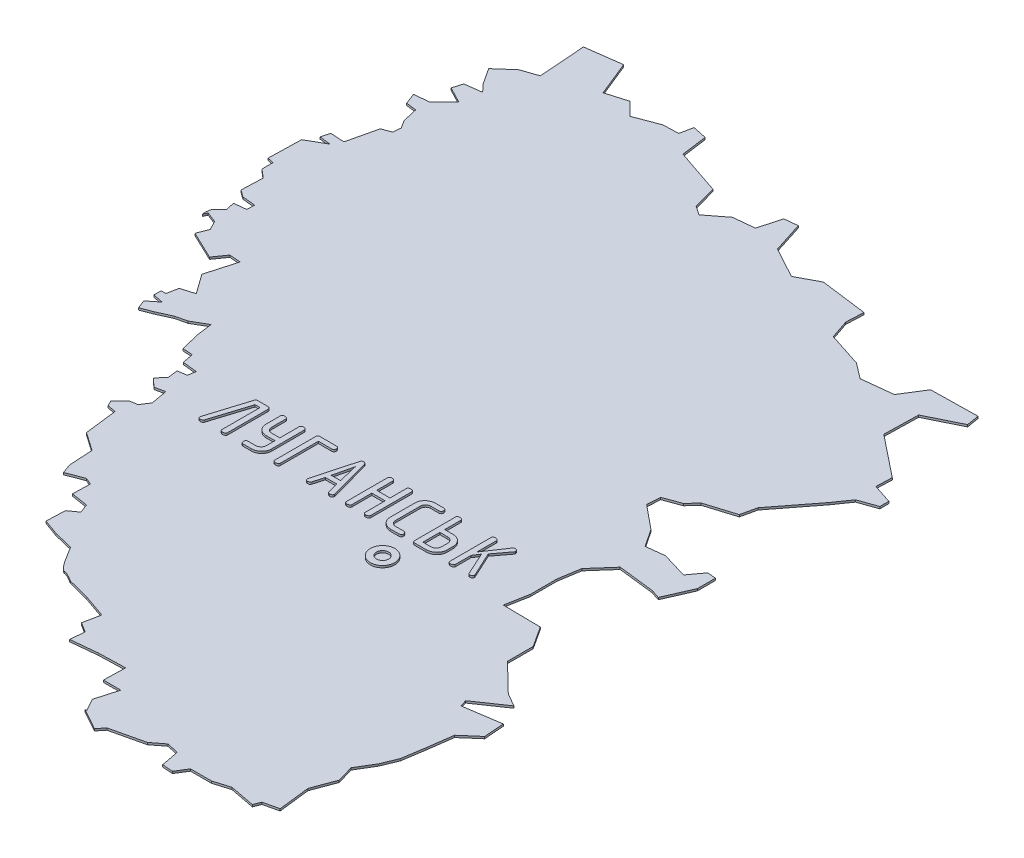
from build123d import *

# Parameters (mm, degrees)
EXTRUDE_7_DEPTH = 5
SKETCH_2_R      = 30
SKETCH_2_R_2    = 15
EXTRUDE_8_DEPTH = 10
SCALE_1_SCALE   = 0.05


with BuildPart() as part:
    # Эскиз1 → Бобышка-Вытянуть7 (new body)
    with BuildSketch(Plane(origin=(0, 0, 0), x_dir=(1, 0, 0), z_dir=(0, 1, 0))):
        with BuildLine():
            Line((5488.13228, 6459.56798), (5449.19408, 6425.18654))
            Line((5449.19408, 6425.18654), (5474.51788, 6386.2458))
            Line((5474.51788, 6386.2458), (5492.02864, 6367.4244))
            Line((5492.02864, 6367.4244), (5451.1448, 6362.22502))
            Line((5451.1448, 6362.22502), (5444.01248, 6338.2017))
            Line((5444.01248, 6338.2017), (5483.60092, 6317.4626))
            Line((5483.60092, 6317.4626), (5447.25098, 6281.76036))
            Line((5447.25098, 6281.76036), (5411.5843, 6278.50916))
            Line((5411.5843, 6278.50916), (5421.95258, 6251.25242))
            Line((5421.95258, 6251.25242), (5447.25098, 6248.01392))
            Line((5447.25098, 6248.01392), (5455.66854, 6211.66398))
            Line((5455.66854, 6211.66398), (5468.05104, 6191.55988))
            Line((5468.05104, 6191.55988), (5466.08254, 6172.75626))
            Line((5466.08254, 6172.75626), (5444.01248, 6164.29806))
            Line((5444.01248, 6164.29806), (5427.1418, 6092.2662))
            Line((5427.1418, 6092.2662), (5392.77814, 6094.20676))
            Line((5392.77814, 6094.20676), (5387.5813, 6073.44988))
            Line((5387.5813, 6073.44988), (5414.81264, 6070.20122))
            Line((5414.81264, 6070.20122), (5370.67506, 6044.89266))
            Line((5370.67506, 6044.89266), (5368.73196, 5964.43054))
            Line((5368.73196, 5964.43054), (5384.29962, 5961.17934))
            Line((5384.29962, 5961.17934), (5384.29962, 5933.9353))
            Line((5384.29962, 5933.9353), (5405.08952, 5916.41184))
            Line((5405.08952, 5916.41184), (5403.12102, 5863.8567))
            Line((5403.12102, 5863.8567), (5420.00186, 5851.51484))
            Line((5420.00186, 5851.51484), (5452.4402, 5848.25348))
            Line((5452.4402, 5848.25348), (5451.1448, 5829.46764))
            Line((5451.1448, 5829.46764), (5421.95258, 5826.20628))
            Line((5421.95258, 5826.20628), (5427.1418, 5805.4367))
            Line((5427.1418, 5805.4367), (5408.33564, 5786.6153))
            Line((5408.33564, 5786.6153), (5406.36714, 5771.69534))
            Line((5406.36714, 5771.69534), (5407.025, 5765.2158))
            Line((5407.025, 5765.2158), (5411.5843, 5774.94654))
            Line((5411.5843, 5774.94654), (5437.53802, 5764.5681))
            Line((5437.53802, 5764.5681), (5449.19408, 5742.50058))
            Line((5449.19408, 5742.50058), (5438.79786, 5715.24892))
            Line((5438.79786, 5715.24892), (5506.93844, 5682.7801))
            Line((5506.93844, 5682.7801), (5527.7385, 5712.00026))
            Line((5527.7385, 5712.00026), (5554.98, 5710.05716))
            Line((5554.98, 5710.05716), (5534.21296, 5636.73498))
            Line((5534.21296, 5636.73498), (5568.6198, 5588.6858))
            Line((5568.6198, 5588.6858), (5536.18146, 5578.95506))
            Line((5536.18146, 5578.95506), (5530.96684, 5551.69832))
            Line((5530.96684, 5551.69832), (5519.2676, 5551.69832))
            Line((5519.2676, 5551.69832), (5519.2676, 5534.17486))
            Line((5519.2676, 5534.17486), (5544.60156, 5528.99834))
            Line((5544.60156, 5528.99834), (5519.2676, 5508.88662))
            Line((5519.2676, 5508.88662), (5527.7385, 5488.11196))
            Line((5527.7385, 5488.11196), (5554.98, 5498.49548))
            Line((5554.98, 5498.49548), (5589.35128, 5514.07584))
            Line((5589.35128, 5514.07584), (5616.6004, 5520.563))
            Line((5616.6004, 5520.563), (5652.32804, 5541.33258))
            Line((5652.32804, 5541.33258), (5657.50964, 5501.73652))
            Line((5657.50964, 5501.73652), (5669.18094, 5455.66092))
            Line((5669.18094, 5455.66092), (5693.21188, 5454.37568))
            Line((5693.21188, 5454.37568), (5698.39094, 5427.10878))
            Line((5698.39094, 5427.10878), (5734.06778, 5423.22258))
            Line((5734.06778, 5423.22258), (5730.82928, 5404.38848))
            Line((5730.82928, 5404.38848), (5708.78716, 5401.13982))
            Line((5708.78716, 5401.13982), (5712.03328, 5377.15206))
            Line((5712.03328, 5377.15206), (5695.188, 5357.01494))
            Line((5695.188, 5357.01494), (5715.31496, 5338.20624))
            Line((5715.31496, 5338.20624), (5739.26462, 5343.39546))
            Line((5739.26462, 5343.39546), (5746.41472, 5302.52178))
            Line((5746.41472, 5302.52178), (5732.79016, 5281.7522))
            Line((5732.79016, 5281.7522), (5713.9586, 5278.50608))
            Line((5713.9586, 5278.50608), (5691.26116, 5256.45126))
            Line((5691.26116, 5256.45126), (5698.39094, 5242.8267))
            Line((5698.39094, 5242.8267), (5719.17322, 5238.9151))
            Line((5719.17322, 5238.9151), (5728.88618, 5159.10576))
            Line((5728.88618, 5159.10576), (5773.65622, 5127.95266))
            Line((5773.65622, 5127.95266), (5776.92774, 5070.21338))
            Line((5776.92774, 5070.21338), (5785.36308, 5046.19768))
            Line((5785.36308, 5046.19768), (5826.22914, 5061.77296))
            Line((5826.22914, 5061.77296), (5843.08204, 5054.59746))
            Line((5843.08204, 5054.59746), (5841.81204, 5011.80354))
            Line((5841.81204, 5011.80354), (5882.6781, 5005.30622))
            Line((5882.6781, 5005.30622), (5891.11344, 4983.24632))
            Line((5891.11344, 4983.24632), (5869.06116, 4967.65072))
            Line((5869.06116, 4967.65072), (5867.11044, 4921.6056))
            Line((5867.11044, 4921.6056), (5904.738, 4907.95056))
            Line((5904.738, 4907.95056), (5952.79734, 4896.26148))
            add(Edge.make_bspline(
                [(5952.79734, 4896.26148), (5985.20774, 4839.83792), (5995.62174, 4837.89482)],
                knots=[0.435483871, 0.435483871, 0.435483871, 0.440860215, 0.440860215, 0.440860215], degree=2))
            add(Edge.make_bspline(
                [(5995.62174, 4837.89482), (6005.32454, 4836.57402), (6024.1561, 4824.25756)],
                knots=[0.440860215, 0.440860215, 0.440860215, 0.446236559, 0.446236559, 0.446236559], degree=2))
            Line((6024.1561, 4824.25756), (6077.35894, 4810.633))
            Line((6077.35894, 4810.633), (6135.13124, 4790.5162))
            Line((6135.13124, 4790.5162), (6126.70352, 4748.97704))
            Line((6126.70352, 4748.97704), (6150.6989, 4734.03168))
            Line((6150.6989, 4734.03168), (6147.47818, 4699.02032))
            Line((6147.47818, 4699.02032), (6212.32692, 4705.49732))
            Line((6212.32692, 4705.49732), (6276.60924, 4707.44804))
            Line((6276.60924, 4707.44804), (6275.27066, 4654.23758))
            Line((6275.27066, 4654.23758), (6318.11284, 4654.23758))
            Line((6318.11284, 4654.23758), (6302.53756, 4599.72156))
            Line((6302.53756, 4599.72156), (6319.42602, 4569.22378))
            Line((6319.42602, 4569.22378), (6314.91244, 4569.22378))
            Line((6314.91244, 4569.22378), (6324.59746, 4564.02694))
            Line((6324.59746, 4564.02694), (6367.4752, 4539.98838))
            Line((6367.4752, 4539.98838), (6381.07436, 4556.9124))
            Line((6381.07436, 4556.9124), (6461.56188, 4575.72618))
            Line((6461.56188, 4575.72618), (6490.09624, 4597.77846))
            Line((6490.09624, 4597.77846), (6519.28846, 4591.27606))
            Line((6519.28846, 4591.27606), (6527.7492, 4547.1461))
            Line((6527.7492, 4547.1461), (6553.68768, 4545.21316))
            Line((6553.68768, 4545.21316), (6570.55836, 4572.46228))
            Line((6570.55836, 4572.46228), (6621.83588, 4572.46228))
            Line((6621.83588, 4572.46228), (6660.79186, 4584.1285))
            Line((6660.79186, 4584.1285), (6722.40464, 4572.46228))
            Line((6722.40464, 4572.46228), (6728.92482, 4589.33296))
            Line((6728.92482, 4589.33296), (6765.24936, 4597.77846))
            Line((6765.24936, 4597.77846), (6756.15616, 4675.00208))
            Line((6756.15616, 4675.00208), (6776.96638, 4730.78556))
            Line((6776.96638, 4730.78556), (6765.24936, 4771.71004))
            Line((6765.24936, 4771.71004), (6790.55538, 4813.88674))
            Line((6790.55538, 4813.88674), (6806.13066, 4851.49652))
            Line((6806.13066, 4851.49652), (6814.566, 4906.01762))
            Line((6814.566, 4906.01762), (6822.96832, 4967.65072))
            Line((6822.96832, 4967.65072), (6862.58978, 5002.06264))
            Line((6862.58978, 5002.06264), (6858.70612, 5051.37674))
            Line((6858.70612, 5051.37674), (6768.5031, 5037.74964))
            Line((6768.5031, 5037.74964), (6763.29864, 5054.59746))
            Line((6763.29864, 5054.59746), (6833.38994, 5102.63902))
            Line((6833.38994, 5102.63902), (6800.93382, 5121.46042))
            Line((6800.93382, 5121.46042), (6730.84252, 5189.601))
            Line((6730.84252, 5189.601), (6730.84252, 5252.54728))
            Line((6730.84252, 5252.54728), (6698.40418, 5302.52178))
            Line((6698.40418, 5302.52178), (6606.27838, 5303.82988))
            Line((6606.27838, 5303.82988), (6616.64666, 5360.26106))
            Line((6616.64666, 5360.26106), (6616.64666, 5425.16568))
            Line((6616.64666, 5425.16568), (6625.082, 5477.7259))
            Line((6625.082, 5477.7259), (6669.2018, 5527.69532))
            Line((6669.2018, 5527.69532), (6758.11704, 5517.32196))
            Line((6758.11704, 5517.32196), (6780.16932, 5510.18202))
            Line((6780.16932, 5510.18202), (6809.35138, 5577.02212))
            Line((6809.35138, 5577.02212), (6809.35138, 5621.147))
            Line((6809.35138, 5621.147), (6788.60466, 5623.07994))
            Line((6788.60466, 5623.07994), (6763.29864, 5588.6858))
            Line((6763.29864, 5588.6858), (6700.33712, 5607.51228))
            Line((6700.33712, 5607.51228), (6655.562, 5602.31544))
            Line((6655.562, 5602.31544), (6626.9997, 5645.15508))
            Line((6626.9997, 5645.15508), (6568.60764, 5693.16362))
            Line((6568.60764, 5693.16362), (6570.55836, 5725.61466))
            Line((6570.55836, 5725.61466), (6611.45744, 5740.56256))
            Line((6611.45744, 5740.56256), (6632.23972, 5763.26))
            Line((6632.23972, 5763.26), (6703.56546, 5785.3326))
            Line((6703.56546, 5785.3326), (6711.98302, 5822.97286))
            Line((6711.98302, 5822.97286), (6787.32704, 5920.31074))
            Line((6787.32704, 5920.31074), (6814.566, 5959.23878))
            Line((6814.566, 5959.23878), (6858.70612, 5974.81406))
            Line((6858.70612, 5974.81406), (6858.70612, 5996.86888))
            Line((6858.70612, 5996.86888), (6811.29448, 6012.45432))
            Line((6811.29448, 6012.45432), (6812.61528, 6051.39252))
            Line((6812.61528, 6051.39252), (6710.08564, 6133.15512))
            Line((6710.08564, 6133.15512), (6711.98302, 6216.8786))
            Line((6711.98302, 6216.8786), (6792.5061, 6256.45434))
            Line((6792.5061, 6256.45434), (6787.32704, 6286.9572))
            Line((6787.32704, 6286.9572), (6673.09562, 6285.01918))
            Line((6673.09562, 6285.01918), (6638.71672, 6230.49046))
            Line((6638.71672, 6230.49046), (6563.43366, 6222.06528))
            Line((6563.43366, 6222.06528), (6524.49546, 6251.25242))
            Line((6524.49546, 6251.25242), (6440.75166, 6278.50916))
            Line((6440.75166, 6278.50916), (6425.17638, 6324.60254))
            Line((6425.17638, 6324.60254), (6427.14488, 6367.4244))
            Line((6427.14488, 6367.4244), (6312.916, 6382.34436))
            Line((6312.916, 6382.34436), (6261.67404, 6355.09524))
            Line((6261.67404, 6355.09524), (6186.3732, 6395.97654))
            Line((6186.3732, 6395.97654), (6162.38036, 6471.25706))
            Line((6162.38036, 6471.25706), (6129.96742, 6468.01856))
            Line((6129.96742, 6468.01856), (6114.99666, 6413.49492))
            Line((6114.99666, 6413.49492), (6063.72676, 6408.31078))
            Line((6063.72676, 6408.31078), (6017.67148, 6372.60854))
            Line((6017.67148, 6372.60854), (5995.62174, 6387.53358))
            Line((5995.62174, 6387.53358), (5980.0617, 6444.01302))
            Line((5980.0617, 6444.01302), (5869.06116, 6481.6228))
            Line((5869.06116, 6481.6228), (5860.60042, 6544.59194))
            Line((5860.60042, 6544.59194), (5826.22914, 6551.72426))
            Line((5826.22914, 6551.72426), (5819.77754, 6520.58386))
            Line((5819.77754, 6520.58386), (5782.11696, 6519.28592))
            Line((5782.11696, 6519.28592), (5723.7249, 6497.20316))
            Line((5723.7249, 6497.20316), (5691.26116, 6529.0065))
            Line((5691.26116, 6529.0065), (5640.64658, 6514.084))
            Line((5640.64658, 6514.084), (5606.23974, 6599.09018))
            Line((5606.23974, 6599.09018), (5519.2676, 6587.40872))
            Line((5519.2676, 6587.40872), (5527.7385, 6473.18746))
            Line((5527.7385, 6473.18746), (5488.13228, 6459.56798))
        make_face()
    extrude(amount=EXTRUDE_7_DEPTH)

    # Эскиз2 → Бобышка-Вытянуть8 (add)
    # profile 1 of 9: a face of its own
    with BuildSketch(Plane(origin=(0, 0, 0), x_dir=(1, 0, 0), z_dir=(0, 1, 0))):
        with Locations((6358.100749634, 5256.002321713)):
            Circle(SKETCH_2_R)
        with Locations((6358.100749634, 5256.002321713)):
            Circle(SKETCH_2_R_2, mode=Mode.SUBTRACT)
    # profile 2 of 9: a face of its own
    with BuildSketch(Plane(origin=(0, 0, 0), x_dir=(1, 0, 0), z_dir=(0, 1, 0))):
        with BuildLine():
            add(Edge.make_bspline(
                [(5907.01062367, 5327.256922732), (5906.992182529, 5326.835668227), (5906.957288543, 5326.038578261), (5906.588560272, 5324.924943171), (5906.006213528, 5323.969128424), (5905.151626094, 5323.206311019), (5904.077030574, 5322.625501675), (5902.779041095, 5322.209033108), (5901.249602894, 5321.996461411), (5900.159426741, 5321.958387605), (5899.578191238, 5321.938088273)],
                knots=[0, 0, 0, 0, 0.969647621, 1.834749252, 2.678145047, 3.526077294, 4.446504318, 5.481227067, 6.657097526, 8, 8, 8, 8], degree=3))
            add(Edge.make_bspline(
                [(5899.578191238, 5321.938088273), (5899.112901019, 5321.958335105), (5898.237879901, 5321.99641114), (5897.006515942, 5322.212069779), (5895.961291597, 5322.633003449), (5895.107162745, 5323.223218695), (5894.419635608, 5323.96803962), (5893.959527946, 5324.902714674), (5893.676744824, 5325.994018893), (5893.647619502, 5326.774994654), (5893.632245292, 5327.187243678)],
                knots=[0, 0, 0, 0, 1.231142298, 2.315276502, 3.288579949, 4.185921389, 5.041168779, 5.938510218, 6.911813665, 8, 8, 8, 8], degree=3))
            Line((5893.632245292, 5327.187243678), (5893.632245292, 5420.046196381))
            Line((5893.632245292, 5420.046196381), (5881.322279076, 5420.046196381))
            Line((5881.322279076, 5420.046196381), (5851.639002049, 5325.67753084))
            add(Edge.make_bspline(
                [(5851.639002049, 5325.67753084), (5851.401384237, 5325.108299549), (5850.930620134, 5323.980548828), (5849.458579502, 5322.73704847), (5847.509006126, 5322.035895245), (5846.063663266, 5321.972617238), (5845.274981779, 5321.938088273)],
                knots=[0, 0, 0, 0, 0.920783868, 1.824240315, 2.812751332, 4, 4, 4, 4], degree=3))
            add(Edge.make_bspline(
                [(5845.274981779, 5321.938088273), (5844.840909494, 5321.958992279), (5844.020180279, 5321.998516868), (5842.861085607, 5322.208186636), (5841.89271693, 5322.64479588), (5841.061741226, 5323.198604113), (5840.451256647, 5323.978726847), (5840.00500688, 5324.895955584), (5839.7497636, 5325.981763405), (5839.717758215, 5326.75230835), (5839.700657454, 5327.164017327)],
                knots=[0, 0, 0, 0, 1.192508042, 2.254753928, 3.205852217, 4.08983164, 4.9656069, 5.887070154, 6.871042903, 8, 8, 8, 8], degree=3))
            add(Edge.make_bspline(
                [(5839.700657454, 5327.164017327), (5839.72420906, 5327.45167498), (5839.77171691, 5328.031932512), (5839.909762824, 5328.597549878), (5839.97937367, 5328.882767327)],
                knots=[0, 0, 0, 0, 0.991482704, 2, 2, 2, 2], degree=3))
            Line((5839.97937367, 5328.882767327), (5870.823968265, 5428.198645705))
            add(Edge.make_bspline(
                [(5870.823968265, 5428.198645705), (5871.044767741, 5428.760050899), (5871.465387876, 5429.829520504), (5872.641523624, 5431.093098808), (5874.205753604, 5431.827812343), (5875.352838264, 5431.900044561), (5875.956991914, 5431.938088273)],
                knots=[0, 0, 0, 0, 1.049874067, 1.999996468, 2.94662576, 4, 4, 4, 4], degree=3))
            Line((5875.956991914, 5431.938088273), (5899.578191238, 5431.938088273))
            add(Edge.make_bspline(
                [(5899.578191238, 5431.938088273), (5900.159426741, 5431.91778894), (5901.249602894, 5431.879715134), (5902.779041095, 5431.667143438), (5904.077030574, 5431.250674871), (5905.151626094, 5430.669865526), (5906.006213528, 5429.907048121), (5906.588560272, 5428.951233374), (5906.957288543, 5427.837598285), (5906.992182529, 5427.040508319), (5907.01062367, 5426.619253813)],
                knots=[0, 0, 0, 0, 1.342902474, 2.518772933, 3.553495682, 4.473922706, 5.321854953, 6.165250748, 7.030352379, 8, 8, 8, 8], degree=3))
            Line((5907.01062367, 5426.619253813), (5907.01062367, 5327.256922732))
        make_face()
    # profile 3 of 9: a face of its own
    with BuildSketch(Plane(origin=(0, 0, 0), x_dir=(1, 0, 0), z_dir=(0, 1, 0))):
        with BuildLine():
            Line((5982.226839887, 5368.019169354), (5960.62633313, 5368.019169354))
            add(Edge.make_bspline(
                [(5960.62633313, 5368.019169354), (5959.789285901, 5368.043239278), (5958.139792897, 5368.090671694), (5955.717100113, 5368.412896355), (5953.396545698, 5368.985637519), (5951.162247271, 5369.738748656), (5949.031232138, 5370.751202103), (5947.006736013, 5371.990807853), (5945.073494792, 5373.439887853), (5943.241677822, 5375.075809027), (5941.597612718, 5376.891767578), (5940.134029435, 5378.813282202), (5938.905924574, 5380.830127595), (5937.894595316, 5382.946738419), (5937.101250237, 5385.155224139), (5936.547342744, 5387.460523405), (5936.214570572, 5389.85771144), (5936.16899692, 5391.484453286), (5936.145758806, 5392.313932867)],
                knots=[0, 0, 0, 0, 1.046542739, 2.062326793, 3.048388737, 4.031023869, 5.005279697, 5.991389151, 6.9942227, 8.022384199, 9.057041184, 10.052136522, 11.038245977, 12.003758709, 12.980463927, 13.966525871, 14.96312665, 16, 16, 16, 16], degree=3))
            Line((5936.145758806, 5392.313932867), (5936.145758806, 5426.642480165))
            add(Edge.make_bspline(
                [(5936.145758806, 5426.642480165), (5936.162191602, 5427.05438252), (5936.193621702, 5427.842205378), (5936.466903552, 5428.945030479), (5936.940839666, 5429.885888281), (5937.611734858, 5430.653227169), (5938.476031902, 5431.242113253), (5939.519649524, 5431.664434995), (5940.751508395, 5431.879666072), (5941.626454448, 5431.917806956), (5942.091704752, 5431.938088273)],
                knots=[0, 0, 0, 0, 1.083429305, 2.072215321, 2.965634013, 3.832377457, 4.725796149, 5.694844779, 6.774239667, 8, 8, 8, 8], degree=3))
            add(Edge.make_bspline(
                [(5942.091704752, 5431.938088273), (5942.673888862, 5431.931850373), (5943.767397691, 5431.920133807), (5945.28467759, 5431.65041086), (5946.596173825, 5431.282765216), (5947.656467429, 5430.689335711), (5948.519233309, 5429.956900194), (5949.101508703, 5429.021624109), (5949.471077777, 5427.931213579), (5949.505784056, 5427.149019759), (5949.524137184, 5426.73538557)],
                knots=[0, 0, 0, 0, 1.353106154, 2.541521659, 3.579288285, 4.507284885, 5.350131461, 6.185231121, 7.040326791, 8, 8, 8, 8], degree=3))
            Line((5949.524137184, 5426.73538557), (5949.524137184, 5393.242986921))
            add(Edge.make_bspline(
                [(5949.524137184, 5393.242986921), (5949.564626668, 5392.293611166), (5949.642829931, 5390.459942934), (5950.360281399, 5387.862449827), (5951.519019159, 5385.54031552), (5953.127295007, 5383.56519729), (5954.998244973, 5381.953678061), (5957.036412572, 5380.793016624), (5959.173256341, 5380.03988703), (5960.651255061, 5379.954101779), (5961.392802724, 5379.911061246)],
                knots=[0, 0, 0, 0, 1.148644306, 2.218544726, 3.238301574, 4.272931153, 5.284625871, 6.213417378, 7.103628338, 8, 8, 8, 8], degree=3))
            Line((5961.392802724, 5379.911061246), (5982.226839887, 5379.911061246))
            Line((5982.226839887, 5379.911061246), (5982.226839887, 5426.73538557))
            add(Edge.make_bspline(
                [(5982.226839887, 5426.73538557), (5982.241248867, 5427.147889029), (5982.2682835, 5427.921842418), (5982.558942732, 5429.002946805), (5983.013671382, 5429.932044959), (5983.702609179, 5430.674011493), (5984.550412065, 5431.273516542), (5985.610128841, 5431.648790268), (5986.827414453, 5431.919544847), (5987.706410609, 5431.931660163), (5988.172785833, 5431.938088273)],
                knots=[0, 0, 0, 0, 1.091529518, 2.047965782, 2.948064081, 3.805939007, 4.706037306, 5.674741692, 6.76627121, 8, 8, 8, 8], degree=3))
            add(Edge.make_bspline(
                [(5988.172785833, 5431.938088273), (5988.754021336, 5431.91778894), (5989.844197489, 5431.879715134), (5991.373635689, 5431.667143438), (5992.671625169, 5431.250674871), (5993.746220688, 5430.669865526), (5994.600808123, 5429.907048121), (5995.183154866, 5428.951233374), (5995.551883138, 5427.837598285), (5995.586777124, 5427.040508319), (5995.605218265, 5426.619253813)],
                knots=[0, 0, 0, 0, 1.342902474, 2.518772933, 3.553495682, 4.473922706, 5.321854953, 6.165250748, 7.030352379, 8, 8, 8, 8], degree=3))
            Line((5995.605218265, 5426.619253813), (5995.605218265, 5346.348983543))
            add(Edge.make_bspline(
                [(5995.605218265, 5346.348983543), (5995.583482749, 5345.550227079), (5995.540433805, 5343.968225462), (5995.178532406, 5341.633453036), (5994.603799343, 5339.373982649), (5993.775452758, 5337.190064861), (5992.729589028, 5335.08478843), (5991.474993716, 5333.038761223), (5989.934858736, 5331.110380034), (5988.223240017, 5329.250172257), (5986.33382766, 5327.536641675), (5984.292393247, 5326.039862524), (5982.138722389, 5324.750636966), (5979.836979963, 5323.73822363), (5977.442727125, 5322.904503214), (5974.913389961, 5322.368223655), (5972.273653496, 5321.998230172), (5970.467924161, 5321.958426648), (5969.545252049, 5321.938088273)],
                knots=[0, 0, 0, 0, 0.964905936, 1.911074051, 2.848363436, 3.778149884, 4.728058265, 5.686180386, 6.672623048, 7.705544358, 8.739058838, 9.749658205, 10.760647355, 11.765817439, 12.783711154, 13.818918533, 14.885534502, 16, 16, 16, 16], degree=3))
            Line((5969.545252049, 5321.938088273), (5950.383512184, 5321.938088273))
            add(Edge.make_bspline(
                [(5950.383512184, 5321.938088273), (5949.96337134, 5321.952593033), (5949.174365758, 5321.979832319), (5948.069841155, 5322.269846415), (5947.120689863, 5322.725451755), (5946.349930037, 5323.404907967), (5945.760537008, 5324.268111785), (5945.338366846, 5325.312056286), (5945.123089078, 5326.54381447), (5945.084955275, 5327.418775795), (5945.064677724, 5327.884034219)],
                knots=[0, 0, 0, 0, 1.101172267, 2.067951921, 2.977421716, 3.842135725, 4.733462525, 5.700242178, 6.77710972, 8, 8, 8, 8], degree=3))
            add(Edge.make_bspline(
                [(5945.064677724, 5327.884034219), (5945.085162146, 5328.349141322), (5945.123684988, 5329.223818075), (5945.33639778, 5330.457452469), (5945.7652169, 5331.491260102), (5946.323406483, 5332.371608317), (5947.091375371, 5333.026685236), (5948.008901949, 5333.510435302), (5949.090959251, 5333.781784049), (5949.863324074, 5333.813426615), (5950.267380427, 5333.829980165)],
                knots=[0, 0, 0, 0, 1.236521053, 2.325391746, 3.302947472, 4.192640581, 5.066993003, 5.950007355, 6.927563081, 8, 8, 8, 8], degree=3))
            Line((5950.267380427, 5333.829980165), (5968.802008806, 5333.829980165))
            add(Edge.make_bspline(
                [(5968.802008806, 5333.829980165), (5969.697198348, 5333.880283631), (5971.448175415, 5333.978676442), (5973.979438456, 5334.722966838), (5976.280182328, 5335.985275314), (5978.343962187, 5337.673760437), (5980.037473143, 5339.725946901), (5981.343818922, 5342.005971293), (5982.075753069, 5344.540201096), (5982.175727708, 5346.29036062), (5982.226839887, 5347.185132192)],
                knots=[0, 0, 0, 0, 1.020971316, 1.997004296, 2.981641766, 3.998934447, 5.021854658, 6.002995704, 6.979028684, 8, 8, 8, 8], degree=3))
            Line((5982.226839887, 5347.185132192), (5982.226839887, 5368.019169354))
        make_face()
    # profile 4 of 9: a face of its own
    with BuildSketch(Plane(origin=(0, 0, 0), x_dir=(1, 0, 0), z_dir=(0, 1, 0))):
        with BuildLine():
            Line((6068.266535833, 5420.046196381), (6036.632245292, 5420.046196381))
            Line((6036.632245292, 5420.046196381), (6036.632245292, 5327.187243678))
            add(Edge.make_bspline(
                [(6036.632245292, 5327.187243678), (6036.612762838, 5326.773969947), (6036.575573406, 5325.98508497), (6036.215422993, 5324.883385729), (6035.626714209, 5323.943158359), (6034.765280844, 5323.208038093), (6033.69972061, 5322.624172989), (6032.400319629, 5322.209459774), (6030.871329835, 5321.996330436), (6029.781084987, 5321.958342058), (6029.19981286, 5321.938088273)],
                knots=[0, 0, 0, 0, 0.957214147, 1.827195396, 2.6601552, 3.500842069, 4.426460774, 5.467019893, 6.649522866, 8, 8, 8, 8], degree=3))
            add(Edge.make_bspline(
                [(6029.19981286, 5321.938088273), (6028.734554436, 5321.958365824), (6027.859593111, 5321.996499626), (6026.627834927, 5322.211777394), (6025.583890426, 5322.633947557), (6024.720686608, 5323.223340585), (6024.041230396, 5323.994100411), (6023.585625056, 5324.943251704), (6023.29561096, 5326.047776306), (6023.268371674, 5326.836781888), (6023.253866914, 5327.256922732)],
                knots=[0, 0, 0, 0, 1.22289028, 2.299757822, 3.266537475, 4.157864275, 5.022578284, 5.932048079, 6.898827733, 8, 8, 8, 8], degree=3))
            Line((6023.253866914, 5327.256922732), (6023.253866914, 5426.619253813))
            add(Edge.make_bspline(
                [(6023.253866914, 5426.619253813), (6023.268371674, 5427.039394657), (6023.29561096, 5427.828400239), (6023.585625056, 5428.932924842), (6024.041230396, 5429.882076134), (6024.720686608, 5430.652835961), (6025.583890426, 5431.242228989), (6026.627834927, 5431.664399152), (6027.859593111, 5431.879676919), (6028.734554436, 5431.917810722), (6029.19981286, 5431.938088273)],
                knots=[0, 0, 0, 0, 1.101172267, 2.067951921, 2.977421716, 3.842135725, 4.733462525, 5.700242178, 6.77710972, 8, 8, 8, 8], degree=3))
            Line((6029.19981286, 5431.938088273), (6068.266535833, 5431.938088273))
            add(Edge.make_bspline(
                [(6068.266535833, 5431.938088273), (6068.801924214, 5431.922226412), (6069.81129175, 5431.892322051), (6071.219990331, 5431.622404432), (6072.418087509, 5431.150006648), (6073.420668928, 5430.503900236), (6074.187187606, 5429.631573953), (6074.735413129, 5428.582296089), (6075.025324833, 5427.338752338), (6075.07094743, 5426.458056441), (6075.09508313, 5425.992142327)],
                knots=[0, 0, 0, 0, 1.239032302, 2.335947183, 3.301339876, 4.206248485, 5.069721959, 5.959770044, 6.920658157, 8, 8, 8, 8], degree=3))
            add(Edge.make_bspline(
                [(6075.09508313, 5425.992142327), (6075.07094743, 5425.526228213), (6075.025324833, 5424.645532316), (6074.735413129, 5423.401988565), (6074.187187606, 5422.3527107), (6073.420668928, 5421.480384417), (6072.418087509, 5420.834278005), (6071.219990331, 5420.361880221), (6069.81129175, 5420.091962603), (6068.801924214, 5420.062058242), (6068.266535833, 5420.046196381)],
                knots=[0, 0, 0, 0, 1.079341843, 2.040229956, 2.930278041, 3.793751515, 4.698660124, 5.664052817, 6.760967698, 8, 8, 8, 8], degree=3))
        make_face()
    # profile 5 of 9: a face of its own
    with BuildSketch(Plane(origin=(0, 0, 0), x_dir=(1, 0, 0), z_dir=(0, 1, 0))):
        with BuildLine():
            Line((6122.137735157, 5351.667818002), (6114.891113535, 5325.747209894))
            add(Edge.make_bspline(
                [(6114.891113535, 5325.747209894), (6114.79497148, 5325.44770828), (6114.60395614, 5324.852657523), (6114.108312199, 5324.067608772), (6113.490257751, 5323.403123881), (6112.748493311, 5322.847011008), (6111.858020385, 5322.444562418), (6110.845179514, 5322.131507189), (6109.692356838, 5321.986851104), (6108.883459486, 5321.954911057), (6108.457414211, 5321.938088273)],
                knots=[0, 0, 0, 0, 0.928778125, 1.845299319, 2.721626903, 3.606912072, 4.5712543, 5.601523306, 6.736725172, 8, 8, 8, 8], degree=3))
            add(Edge.make_bspline(
                [(6108.457414211, 5321.938088273), (6108.029572973, 5321.944185051), (6107.226799471, 5321.955624649), (6106.11681403, 5322.228878563), (6105.151457518, 5322.609964468), (6104.374873711, 5323.203474967), (6103.769177122, 5323.952581087), (6103.351346123, 5324.862037807), (6103.095502553, 5325.927014038), (6103.062926446, 5326.69017374), (6103.045674346, 5327.094338273)],
                knots=[0, 0, 0, 0, 1.195591587, 2.243330376, 3.186719882, 4.085348966, 4.949772643, 5.862447722, 6.867965887, 8, 8, 8, 8], degree=3))
            add(Edge.make_bspline(
                [(6103.045674346, 5327.094338273), (6103.055290435, 5327.335034237), (6103.075898921, 5327.850875878), (6103.177364339, 5328.357205446), (6103.231485157, 5328.627277462)],
                knots=[0, 0, 0, 0, 0.933216494, 2, 2, 2, 2], degree=3))
            Line((6103.231485157, 5328.627277462), (6130.174052724, 5427.385723408))
            add(Edge.make_bspline(
                [(6130.174052724, 5427.385723408), (6130.387899361, 5428.071078426), (6130.781946097, 5429.333955001), (6131.952383244, 5430.85582047), (6133.517702294, 5431.806214018), (6134.697935078, 5431.893195449), (6135.307076373, 5431.938088273)],
                knots=[0, 0, 0, 0, 1.14881934, 2.116883943, 3.028086856, 4, 4, 4, 4], degree=3))
            add(Edge.make_bspline(
                [(6135.307076373, 5431.938088273), (6135.725729312, 5431.924891501), (6136.530031153, 5431.899538311), (6137.680251609, 5431.702898125), (6138.688952185, 5431.314529036), (6139.601337142, 5430.832499749), (6140.363136208, 5430.171918079), (6141.016769635, 5429.388153558), (6141.500928876, 5428.439104228), (6141.720020973, 5427.745532874), (6141.833681103, 5427.385723408)],
                knots=[0, 0, 0, 0, 1.159973446, 2.228501676, 3.212538073, 4.143733404, 5.071959985, 5.986456493, 6.955418201, 8, 8, 8, 8], degree=3))
            Line((6141.833681103, 5427.385723408), (6168.753022319, 5328.627277462))
            add(Edge.make_bspline(
                [(6168.753022319, 5328.627277462), (6168.820197293, 5328.365069401), (6168.949661838, 5327.859722764), (6169.020758154, 5327.342966425), (6169.054964887, 5327.094338273)],
                knots=[0, 0, 0, 0, 1.037735456, 2, 2, 2, 2], degree=3))
            add(Edge.make_bspline(
                [(6169.054964887, 5327.094338273), (6169.033663056, 5326.689213783), (6168.993144055, 5325.918611487), (6168.661083309, 5324.843346441), (6168.115859006, 5323.928190989), (6167.333988161, 5323.185785828), (6166.344653067, 5322.598771165), (6165.126983324, 5322.226431367), (6163.717133232, 5321.955225819), (6162.700310864, 5321.944058234), (6162.156738535, 5321.938088273)],
                knots=[0, 0, 0, 0, 0.990235882, 1.883564343, 2.725541743, 3.57007576, 4.496574784, 5.51560207, 6.671891955, 8, 8, 8, 8], degree=3))
            add(Edge.make_bspline(
                [(6162.156738535, 5321.938088273), (6161.542934484, 5321.971523208), (6160.388075069, 5322.034430336), (6158.846593421, 5322.812919205), (6157.67146362, 5324.07650332), (6157.293783348, 5325.168054971), (6157.093393941, 5325.747209894)],
                knots=[0, 0, 0, 0, 1.06375675, 2.001435954, 2.939602898, 4, 4, 4, 4], degree=3))
            Line((6157.093393941, 5325.747209894), (6149.846772319, 5351.667818002))
            Line((6149.846772319, 5351.667818002), (6122.137735157, 5351.667818002))
        make_face()
        Polygon((6147.431231779, 5363.559709894), (6136.003866914, 5411.289861921), (6124.646181103, 5363.559709894), align=None, mode=Mode.SUBTRACT)
    # profile 6 of 9: a face of its own
    with BuildSketch(Plane(origin=(0, 0, 0), x_dir=(1, 0, 0), z_dir=(0, 1, 0))):
        with BuildLine():
            Line((6245.037650697, 5387.343493678), (6245.037650697, 5426.73538557))
            add(Edge.make_bspline(
                [(6245.037650697, 5426.73538557), (6245.052059678, 5427.147889029), (6245.079094311, 5427.921842418), (6245.369753543, 5429.002946805), (6245.824482192, 5429.932044959), (6246.51341999, 5430.674011493), (6247.361222875, 5431.273516542), (6248.420939652, 5431.648790268), (6249.638225263, 5431.919544847), (6250.517221419, 5431.931660163), (6250.983596643, 5431.938088273)],
                knots=[0, 0, 0, 0, 1.091529518, 2.047965782, 2.948064081, 3.805939007, 4.706037306, 5.674741692, 6.76627121, 8, 8, 8, 8], degree=3))
            add(Edge.make_bspline(
                [(6250.983596643, 5431.938088273), (6251.564832146, 5431.91778894), (6252.6550083, 5431.879715134), (6254.1844465, 5431.667143438), (6255.48243598, 5431.250674871), (6256.557031499, 5430.669865526), (6257.411618934, 5429.907048121), (6257.993965677, 5428.951233374), (6258.362693949, 5427.837598285), (6258.397587934, 5427.040508319), (6258.416029076, 5426.619253813)],
                knots=[0, 0, 0, 0, 1.342902474, 2.518772933, 3.553495682, 4.473922706, 5.321854953, 6.165250748, 7.030352379, 8, 8, 8, 8], degree=3))
            Line((6258.416029076, 5426.619253813), (6258.416029076, 5327.256922732))
            add(Edge.make_bspline(
                [(6258.416029076, 5327.256922732), (6258.397587934, 5326.835668227), (6258.362693949, 5326.038578261), (6257.993965677, 5324.924943171), (6257.411618934, 5323.969128424), (6256.557031499, 5323.206311019), (6255.48243598, 5322.625501675), (6254.1844465, 5322.209033108), (6252.6550083, 5321.996461411), (6251.564832146, 5321.958387605), (6250.983596643, 5321.938088273)],
                knots=[0, 0, 0, 0, 0.969647621, 1.834749252, 2.678145047, 3.526077294, 4.446504318, 5.481227067, 6.657097526, 8, 8, 8, 8], degree=3))
            add(Edge.make_bspline(
                [(6250.983596643, 5321.938088273), (6250.518338219, 5321.958365824), (6249.643376895, 5321.996499626), (6248.411618711, 5322.211777394), (6247.36767421, 5322.633947557), (6246.504470391, 5323.223340585), (6245.82501418, 5323.994100411), (6245.369408839, 5324.943251704), (6245.079394744, 5326.047776306), (6245.052155458, 5326.836781888), (6245.037650697, 5327.256922732)],
                knots=[0, 0, 0, 0, 1.22289028, 2.299757822, 3.266537475, 4.157864275, 5.022578284, 5.932048079, 6.898827733, 8, 8, 8, 8], degree=3))
            Line((6245.037650697, 5327.256922732), (6245.037650697, 5375.451601786))
            Line((6245.037650697, 5375.451601786), (6212.334947995, 5375.451601786))
            Line((6212.334947995, 5375.451601786), (6212.334947995, 5327.256922732))
            add(Edge.make_bspline(
                [(6212.334947995, 5327.256922732), (6212.316506853, 5326.835668227), (6212.281612868, 5326.038578261), (6211.912884596, 5324.924943171), (6211.330537853, 5323.969128424), (6210.475950418, 5323.206311019), (6209.401354899, 5322.625501675), (6208.103365419, 5322.209033108), (6206.573927218, 5321.996461411), (6205.483751065, 5321.958387605), (6204.902515562, 5321.938088273)],
                knots=[0, 0, 0, 0, 0.969647621, 1.834749252, 2.678145047, 3.526077294, 4.446504318, 5.481227067, 6.657097526, 8, 8, 8, 8], degree=3))
            add(Edge.make_bspline(
                [(6204.902515562, 5321.938088273), (6204.437257138, 5321.958365824), (6203.562295814, 5321.996499626), (6202.33053763, 5322.211777394), (6201.286593129, 5322.633947557), (6200.42338931, 5323.223340585), (6199.743933099, 5323.994100411), (6199.288327758, 5324.943251704), (6198.998313663, 5326.047776306), (6198.971074377, 5326.836781888), (6198.956569616, 5327.256922732)],
                knots=[0, 0, 0, 0, 1.22289028, 2.299757822, 3.266537475, 4.157864275, 5.022578284, 5.932048079, 6.898827733, 8, 8, 8, 8], degree=3))
            Line((6198.956569616, 5327.256922732), (6198.956569616, 5426.619253813))
            add(Edge.make_bspline(
                [(6198.956569616, 5426.619253813), (6198.971074377, 5427.039394657), (6198.998313663, 5427.828400239), (6199.288327758, 5428.932924842), (6199.743933099, 5429.882076134), (6200.42338931, 5430.652835961), (6201.286593129, 5431.242228989), (6202.33053763, 5431.664399152), (6203.562295814, 5431.879676919), (6204.437257138, 5431.917810722), (6204.902515562, 5431.938088273)],
                knots=[0, 0, 0, 0, 1.101172267, 2.067951921, 2.977421716, 3.842135725, 4.733462525, 5.700242178, 6.77710972, 8, 8, 8, 8], degree=3))
            add(Edge.make_bspline(
                [(6204.902515562, 5431.938088273), (6205.484699673, 5431.931850373), (6206.578208502, 5431.920133807), (6208.0954884, 5431.65041086), (6209.406984636, 5431.282765216), (6210.46727824, 5430.689335711), (6211.33004412, 5429.956900194), (6211.912319514, 5429.021624109), (6212.281888588, 5427.931213579), (6212.316594867, 5427.149019759), (6212.334947995, 5426.73538557)],
                knots=[0, 0, 0, 0, 1.353106154, 2.541521659, 3.579288285, 4.507284885, 5.350131461, 6.185231121, 7.040326791, 8, 8, 8, 8], degree=3))
            Line((6212.334947995, 5426.73538557), (6212.334947995, 5387.343493678))
            Line((6212.334947995, 5387.343493678), (6245.037650697, 5387.343493678))
        make_face()
    # profile 7 of 9: a face of its own
    with BuildSketch(Plane(origin=(0, 0, 0), x_dir=(1, 0, 0), z_dir=(0, 1, 0))):
        with BuildLine():
            Line((6331.077346643, 5321.938088273), (6311.915606779, 5321.938088273))
            add(Edge.make_bspline(
                [(6311.915606779, 5321.938088273), (6311.078488579, 5321.96207375), (6309.421181482, 5322.009559638), (6306.969522758, 5322.338201502), (6304.599291314, 5322.897990694), (6302.296531715, 5323.67260014), (6300.066388689, 5324.666167482), (6297.922789528, 5325.913746702), (6295.851132589, 5327.36124455), (6293.861395164, 5328.990702986), (6292.057049175, 5330.802496697), (6290.451406526, 5332.722600178), (6289.096501858, 5334.755129841), (6287.982783856, 5336.88829952), (6287.109067744, 5339.113948809), (6286.511688913, 5341.438780749), (6286.122649152, 5343.8583583), (6286.084175388, 5345.511305802), (6286.064677724, 5346.348983543)],
                knots=[0, 0, 0, 0, 1.018867561, 2.017130245, 3.004614605, 3.979107864, 4.970407086, 5.970980155, 6.993154606, 8.044116266, 9.096977523, 10.100873513, 11.086242139, 12.064146942, 13.024919106, 13.989519707, 14.981132439, 16, 16, 16, 16], degree=3))
            Line((6286.064677724, 5346.348983543), (6286.064677724, 5407.527193002))
            add(Edge.make_bspline(
                [(6286.064677724, 5407.527193002), (6286.08347795, 5408.364986366), (6286.120403643, 5410.010503942), (6286.517842139, 5412.428393288), (6287.105256839, 5414.755223545), (6287.97719525, 5416.983232356), (6289.103438331, 5419.101899066), (6290.450774654, 5421.130548394), (6292.056345464, 5423.051375031), (6293.868580318, 5424.861639285), (6295.845125168, 5426.513135103), (6297.919039971, 5427.976145762), (6300.093948706, 5429.1629462), (6302.299894467, 5430.223446909), (6304.611144255, 5430.966239497), (6306.975811968, 5431.54280844), (6309.421489736, 5431.865628026), (6311.078592028, 5431.913770931), (6311.915606779, 5431.938088273)],
                knots=[0, 0, 0, 0, 1.0191145, 2.001652071, 2.975606382, 3.936611404, 4.906405939, 5.892013384, 6.896152684, 7.949269119, 9.006511641, 10.028933832, 11.033294323, 12.020163057, 13.003830373, 13.982380872, 14.9808855, 16, 16, 16, 16], degree=3))
            Line((6311.915606779, 5431.938088273), (6331.077346643, 5431.938088273))
            add(Edge.make_bspline(
                [(6331.077346643, 5431.938088273), (6331.612735025, 5431.922226412), (6332.622102561, 5431.892322051), (6334.030801142, 5431.622404432), (6335.22889832, 5431.150006648), (6336.231479739, 5430.503900236), (6336.997998417, 5429.631573953), (6337.54622394, 5428.582296089), (6337.836135644, 5427.338752338), (6337.881758241, 5426.458056441), (6337.905893941, 5425.992142327)],
                knots=[0, 0, 0, 0, 1.239032302, 2.335947183, 3.301339876, 4.206248485, 5.069721959, 5.959770044, 6.920658157, 8, 8, 8, 8], degree=3))
            add(Edge.make_bspline(
                [(6337.905893941, 5425.992142327), (6337.881758241, 5425.526228213), (6337.836135644, 5424.645532316), (6337.54622394, 5423.401988565), (6336.997998417, 5422.3527107), (6336.231479739, 5421.480384417), (6335.22889832, 5420.834278005), (6334.030801142, 5420.361880221), (6332.622102561, 5420.091962603), (6331.612735025, 5420.062058242), (6331.077346643, 5420.046196381)],
                knots=[0, 0, 0, 0, 1.079341843, 2.040229956, 2.930278041, 3.793751515, 4.698660124, 5.664052817, 6.760967698, 8, 8, 8, 8], degree=3))
            Line((6331.077346643, 5420.046196381), (6311.915606779, 5420.046196381))
            add(Edge.make_bspline(
                [(6311.915606779, 5420.046196381), (6311.135792162, 5420.002857455), (6309.582948269, 5419.916556706), (6307.325661063, 5419.169687867), (6305.186994734, 5417.994980162), (6303.23744681, 5416.364401328), (6301.529395136, 5414.412552014), (6300.326426044, 5412.067732215), (6299.551906168, 5409.465247385), (6299.480033086, 5407.618120593), (6299.443056103, 5406.667818002)],
                knots=[0, 0, 0, 0, 0.919483398, 1.830966167, 2.780942374, 3.788393713, 4.820470715, 5.823133069, 6.880053989, 8, 8, 8, 8], degree=3))
            Line((6299.443056103, 5406.667818002), (6299.443056103, 5347.208358543))
            add(Edge.make_bspline(
                [(6299.443056103, 5347.208358543), (6299.481473834, 5346.250998449), (6299.555469787, 5344.407038121), (6300.300698919, 5341.785335622), (6301.530909244, 5339.460113812), (6303.212735001, 5337.472635), (6305.176621447, 5335.86978716), (6307.318457603, 5334.698557762), (6309.576357558, 5333.962579712), (6311.136062777, 5333.874168351), (6311.915606779, 5333.829980165)],
                knots=[0, 0, 0, 0, 1.127983622, 2.172596354, 3.186649798, 4.21184702, 5.225406005, 6.162066987, 7.081397153, 8, 8, 8, 8], degree=3))
            Line((6311.915606779, 5333.829980165), (6331.077346643, 5333.829980165))
            add(Edge.make_bspline(
                [(6331.077346643, 5333.829980165), (6331.612735025, 5333.814118304), (6332.622102561, 5333.784213943), (6334.030801142, 5333.514296324), (6335.22889832, 5333.04189854), (6336.231479739, 5332.395792128), (6336.997998417, 5331.523465845), (6337.54622394, 5330.474187981), (6337.836135644, 5329.230644229), (6337.881758241, 5328.349948333), (6337.905893941, 5327.884034219)],
                knots=[0, 0, 0, 0, 1.239032302, 2.335947183, 3.301339876, 4.206248485, 5.069721959, 5.959770044, 6.920658157, 8, 8, 8, 8], degree=3))
            add(Edge.make_bspline(
                [(6337.905893941, 5327.884034219), (6337.881758241, 5327.418120105), (6337.836135644, 5326.537424208), (6337.54622394, 5325.293880457), (6336.997998417, 5324.244602592), (6336.231479739, 5323.372276309), (6335.22889832, 5322.726169897), (6334.030801142, 5322.253772113), (6332.622102561, 5321.983854495), (6331.612735025, 5321.953950134), (6331.077346643, 5321.938088273)],
                knots=[0, 0, 0, 0, 1.079341843, 2.040229956, 2.930278041, 3.793751515, 4.698660124, 5.664052817, 6.760967698, 8, 8, 8, 8], degree=3))
        make_face()
    # profile 8 of 9: a face of its own
    with BuildSketch(Plane(origin=(0, 0, 0), x_dir=(1, 0, 0), z_dir=(0, 1, 0))):
        with BuildLine():
            add(Edge.make_bspline(
                [(6425.19981286, 5346.859963273), (6425.177270238, 5346.045970772), (6425.132618597, 5344.433642722), (6424.782164243, 5342.047496971), (6424.161228156, 5339.745145074), (6423.363903565, 5337.497815934), (6422.271907774, 5335.353089877), (6420.969385145, 5333.268303275), (6419.403577884, 5331.284278636), (6417.654932904, 5329.380652005), (6415.709528338, 5327.657719538), (6413.646623686, 5326.101201935), (6411.427834269, 5324.832908755), (6409.102729816, 5323.776869395), (6406.658409945, 5322.926970312), (6404.076564318, 5322.364628795), (6401.380024468, 5321.999604086), (6399.543678204, 5321.958887178), (6398.605640562, 5321.938088273)],
                knots=[0, 0, 0, 0, 0.963633486, 1.908731712, 2.847047916, 3.78375066, 4.726667904, 5.690606565, 6.689985837, 7.714895885, 8.747199612, 9.762926321, 10.769218895, 11.7661145, 12.783659731, 13.826693924, 14.88983742, 16, 16, 16, 16], degree=3))
            Line((6398.605640562, 5321.938088273), (6371.152093265, 5321.938088273))
            add(Edge.make_bspline(
                [(6371.152093265, 5321.938088273), (6370.725456422, 5321.957995634), (6369.927060046, 5321.995249717), (6368.801592673, 5322.213941593), (6367.852793056, 5322.64085401), (6367.061210916, 5323.22572241), (6366.457863814, 5324.006833679), (6366.051391732, 5324.950101589), (6365.787426518, 5326.050641278), (6365.756735342, 5326.837124054), (6365.7403534, 5327.256922732)],
                knots=[0, 0, 0, 0, 1.178388678, 2.205203945, 3.142513155, 4.02719224, 4.89493436, 5.832243571, 6.842922806, 8, 8, 8, 8], degree=3))
            Line((6365.7403534, 5327.256922732), (6365.7403534, 5426.619253813))
            add(Edge.make_bspline(
                [(6365.7403534, 5426.619253813), (6365.75485816, 5427.039394657), (6365.782097447, 5427.828400239), (6366.072111542, 5428.932924842), (6366.527716883, 5429.882076134), (6367.207173094, 5430.652835961), (6368.070376913, 5431.242228989), (6369.114321414, 5431.664399152), (6370.346079597, 5431.879676919), (6371.221040922, 5431.917810722), (6371.686299346, 5431.938088273)],
                knots=[0, 0, 0, 0, 1.101172267, 2.067951921, 2.977421716, 3.842135725, 4.733462525, 5.700242178, 6.77710972, 8, 8, 8, 8], degree=3))
            add(Edge.make_bspline(
                [(6371.686299346, 5431.938088273), (6372.268483457, 5431.931850373), (6373.361992286, 5431.920133807), (6374.879272184, 5431.65041086), (6376.19076842, 5431.282765216), (6377.251062024, 5430.689335711), (6378.113827904, 5429.956900194), (6378.696103298, 5429.021624109), (6379.065672372, 5427.931213579), (6379.10037865, 5427.149019759), (6379.118731779, 5426.73538557)],
                knots=[0, 0, 0, 0, 1.353106154, 2.541521659, 3.579288285, 4.507284885, 5.350131461, 6.185231121, 7.040326791, 8, 8, 8, 8], degree=3))
            Line((6379.118731779, 5426.73538557), (6379.118731779, 5387.343493678))
            Line((6379.118731779, 5387.343493678), (6399.139846643, 5387.343493678))
            add(Edge.make_bspline(
                [(6399.139846643, 5387.343493678), (6400.054376801, 5387.321290216), (6401.851576064, 5387.277656833), (6404.492493701, 5386.930362402), (6407.005465834, 5386.312284383), (6409.421454112, 5385.512221762), (6411.693208637, 5384.431579944), (6413.861938229, 5383.141926697), (6415.9032209, 5381.609503877), (6417.794864705, 5379.843989688), (6419.509004338, 5377.93950762), (6421.045337543, 5375.956767009), (6422.315032193, 5373.886725143), (6423.381320753, 5371.755101136), (6424.192931968, 5369.54121537), (6424.774163158, 5367.253434404), (6425.134753839, 5364.895067338), (6425.177985902, 5363.297749718), (6425.19981286, 5362.491297732)],
                knots=[0, 0, 0, 0, 1.096850268, 2.155487685, 3.187140075, 4.197419692, 5.202821391, 6.198265597, 7.219836451, 8.258155485, 9.297055814, 10.290809041, 11.262444892, 12.205247722, 13.145485597, 14.084759807, 15.03303561, 16, 16, 16, 16], degree=3))
            Line((6425.19981286, 5362.491297732), (6425.19981286, 5346.859963273))
        make_face()
        with BuildLine():
            Line((6411.821434481, 5347.231584894), (6411.821434481, 5362.119676111))
            add(Edge.make_bspline(
                [(6411.821434481, 5362.119676111), (6411.771849149, 5362.99976689), (6411.673905408, 5364.738171771), (6410.908002081, 5367.235447386), (6409.633973607, 5369.529013224), (6407.905825433, 5371.553443018), (6405.854797277, 5373.272028878), (6403.556333287, 5374.562219599), (6401.02651977, 5375.299400992), (6399.283801764, 5375.400257076), (6398.3966034, 5375.451601786)],
                knots=[0, 0, 0, 0, 1.005936902, 1.986983231, 2.958581705, 3.989798119, 5.015327389, 6.006721754, 6.985244203, 8, 8, 8, 8], degree=3))
            Line((6398.3966034, 5375.451601786), (6379.118731779, 5375.451601786))
            Line((6379.118731779, 5375.451601786), (6379.118731779, 5333.829980165))
            Line((6379.118731779, 5333.829980165), (6398.3966034, 5333.829980165))
            add(Edge.make_bspline(
                [(6398.3966034, 5333.829980165), (6399.291887093, 5333.880173838), (6401.043048317, 5333.978351895), (6403.572972881, 5334.724203152), (6405.883211594, 5335.982894807), (6407.930057944, 5337.698992694), (6409.640946705, 5339.751189715), (6410.932261118, 5342.048361743), (6411.671461956, 5344.585994378), (6411.770699264, 5346.336590243), (6411.821434481, 5347.231584894)],
                knots=[0, 0, 0, 0, 1.019269311, 1.9936752, 2.976671234, 3.99788619, 5.019101147, 6.0063248, 6.980730689, 8, 8, 8, 8], degree=3))
        make_face(mode=Mode.SUBTRACT)
    # profile 9 of 9: a face of its own
    with BuildSketch(Plane(origin=(0, 0, 0), x_dir=(1, 0, 0), z_dir=(0, 1, 0))):
        with BuildLine():
            Line((6466.226839887, 5364.674574759), (6466.226839887, 5327.303375435))
            add(Edge.make_bspline(
                [(6466.226839887, 5327.303375435), (6466.207318135, 5326.882412291), (6466.170036851, 5326.078486117), (6465.810204158, 5324.954410654), (6465.222825946, 5323.990970502), (6464.36169649, 5323.23290384), (6463.300890092, 5322.619605347), (6461.993981087, 5322.211294624), (6460.466210877, 5321.995767186), (6459.375779195, 5321.958146187), (6458.794407454, 5321.938088273)],
                knots=[0, 0, 0, 0, 0.966526808, 1.845805764, 2.686487088, 3.531690263, 4.457941251, 5.489333743, 6.661419661, 8, 8, 8, 8], degree=3))
            add(Edge.make_bspline(
                [(6458.794407454, 5321.938088273), (6458.32914903, 5321.958365824), (6457.454187706, 5321.996499626), (6456.222429522, 5322.211777394), (6455.178485021, 5322.633947557), (6454.315281202, 5323.223340585), (6453.635824991, 5323.994100411), (6453.18021965, 5324.943251704), (6452.890205555, 5326.047776306), (6452.862966268, 5326.836781888), (6452.848461508, 5327.256922732)],
                knots=[0, 0, 0, 0, 1.22289028, 2.299757822, 3.266537475, 4.157864275, 5.022578284, 5.932048079, 6.898827733, 8, 8, 8, 8], degree=3))
            Line((6452.848461508, 5327.256922732), (6452.848461508, 5426.619253813))
            add(Edge.make_bspline(
                [(6452.848461508, 5426.619253813), (6452.862966268, 5427.039394657), (6452.890205555, 5427.828400239), (6453.18021965, 5428.932924842), (6453.635824991, 5429.882076134), (6454.315281202, 5430.652835961), (6455.178485021, 5431.242228989), (6456.222429522, 5431.664399152), (6457.454187706, 5431.879676919), (6458.32914903, 5431.917810722), (6458.794407454, 5431.938088273)],
                knots=[0, 0, 0, 0, 1.101172267, 2.067951921, 2.977421716, 3.842135725, 4.733462525, 5.700242178, 6.77710972, 8, 8, 8, 8], degree=3))
            add(Edge.make_bspline(
                [(6458.794407454, 5431.938088273), (6459.375495115, 5431.917531434), (6460.465393971, 5431.878974645), (6461.99664225, 5431.669555664), (6463.285405308, 5431.244327202), (6464.374988931, 5430.69734613), (6465.21324768, 5429.931048169), (6465.811475802, 5428.994563713), (6466.169753225, 5427.890587292), (6466.207214843, 5427.102033238), (6466.226839887, 5426.688932867)],
                knots=[0, 0, 0, 0, 1.349898262, 2.531894363, 3.572007453, 4.488635547, 5.340985057, 6.173587819, 7.043196157, 8, 8, 8, 8], degree=3))
            Line((6466.226839887, 5426.688932867), (6466.226839887, 5379.214270705))
            Line((6466.226839887, 5379.214270705), (6501.321856779, 5431.171618678))
            add(Edge.make_bspline(
                [(6501.321856779, 5431.171618678), (6501.594010421, 5431.510865043), (6502.123907202, 5432.171394718), (6503.142274056, 5432.907215664), (6504.306761081, 5433.352478509), (6505.127010907, 5433.400081612), (6505.549052724, 5433.424574759)],
                knots=[0, 0, 0, 0, 1.043405265, 2.031562344, 2.987182952, 4, 4, 4, 4], degree=3))
            add(Edge.make_bspline(
                [(6505.549052724, 5433.424574759), (6506.046355866, 5433.403233855), (6507.007753725, 5433.36197713), (6508.38299915, 5433.01710794), (6509.587047408, 5432.390306403), (6510.623160061, 5431.590344966), (6511.427311134, 5430.673060947), (6512.060082339, 5429.782685708), (6512.468981317, 5428.889952211), (6512.517247647, 5428.279638257), (6512.540184481, 5427.989608543)],
                knots=[0, 0, 0, 0, 1.232201872, 2.382120968, 3.480921289, 4.575185605, 5.608136879, 6.491925667, 7.283342016, 8, 8, 8, 8], degree=3))
            add(Edge.make_bspline(
                [(6512.540184481, 5427.989608543), (6512.487820362, 5427.53604757), (6512.376045684, 5426.567891669), (6511.8159353, 5425.767323215), (6511.518225022, 5425.341804489)],
                knots=[0, 0, 0, 0, 0.936958546, 2, 2, 2, 2], degree=3))
            Line((6511.518225022, 5425.341804489), (6484.296941238, 5388.969338273))
            Line((6484.296941238, 5388.969338273), (6511.796941238, 5329.509878813))
            add(Edge.make_bspline(
                [(6511.796941238, 5329.509878813), (6511.985328998, 5329.075267345), (6512.314952258, 5328.314824896), (6512.407587249, 5327.492945979), (6512.447279076, 5327.140790975)],
                knots=[0, 0, 0, 0, 1.143048942, 2, 2, 2, 2], degree=3))
            add(Edge.make_bspline(
                [(6512.447279076, 5327.140790975), (6512.424884016, 5326.736042452), (6512.381875806, 5325.958750059), (6512.059382376, 5324.871763108), (6511.500239701, 5323.94471857), (6510.719205785, 5323.186846285), (6509.695417421, 5322.629625295), (6508.481049878, 5322.209559071), (6507.042606846, 5321.997110949), (6506.021857382, 5321.95857072), (6505.47937367, 5321.938088273)],
                knots=[0, 0, 0, 0, 0.980941784, 1.883832903, 2.71790772, 3.581067539, 4.489409537, 5.522692817, 6.683419545, 8, 8, 8, 8], degree=3))
            add(Edge.make_bspline(
                [(6505.47937367, 5321.938088273), (6504.967951484, 5322.003735442), (6503.914730508, 5322.138928982), (6502.537815646, 5323.2381238), (6501.450982142, 5324.928312779), (6500.964969075, 5326.305432109), (6500.694745292, 5327.071111921)],
                knots=[0, 0, 0, 0, 0.811433687, 1.671063562, 2.705108864, 4, 4, 4, 4], degree=3))
            Line((6500.694745292, 5327.071111921), (6476.237397319, 5380.561399084))
            Line((6476.237397319, 5380.561399084), (6466.226839887, 5364.674574759))
        make_face()
    extrude(amount=EXTRUDE_8_DEPTH)


with BuildPart() as part_1:
    # Масштаб1: scaled about (6153.105439811, 2.560523737, -5610.934273925)
    add(part.part.scale(SCALE_1_SCALE).moved(Location((5845.45016782, 2.43249755, -5330.387560229))))


solid = part_1.part
